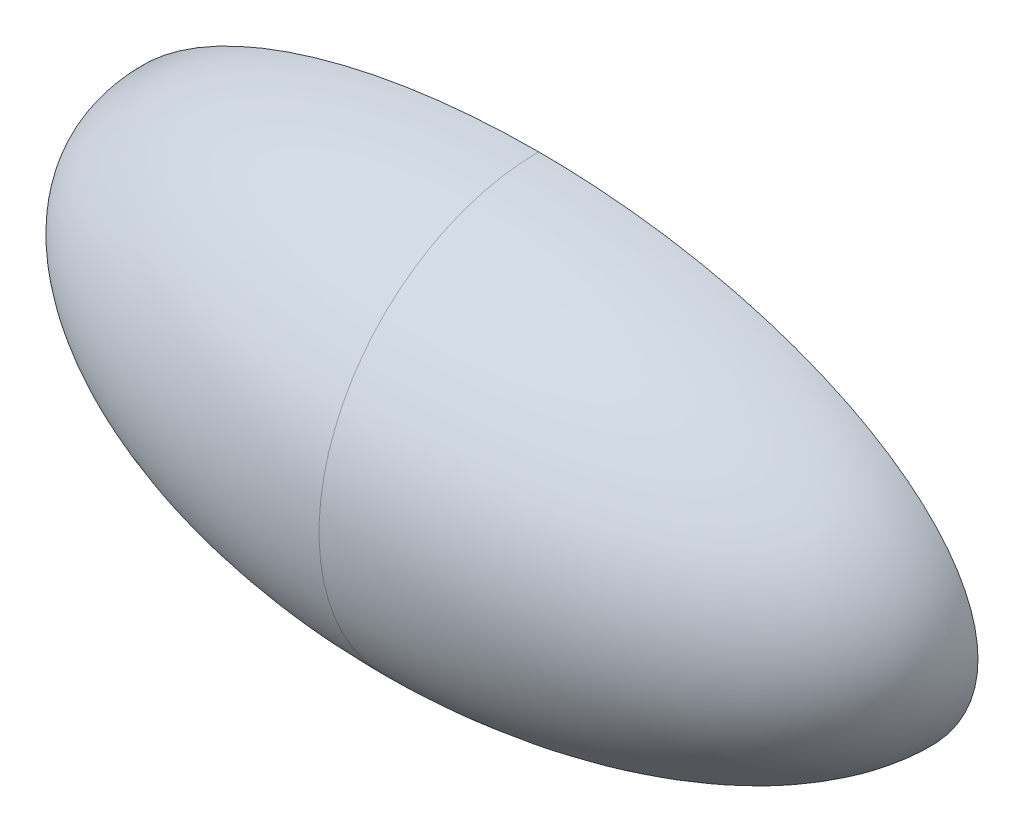
from build123d import *

# Parameters (mm, degrees)
REVOLVE1_ANGLE = 180


with BuildPart() as part:
    # Sketch1 → Revolve1 (revolve)
    with BuildSketch(Plane.XY):
        with BuildLine():
            Line((-12.049635499, 0), (12, 0))
            add(Edge.make_bspline(
                [(12, 0), (12, 6), (0, 6)],
                knots=[0, 0, 0, 1.570796327, 1.570796327, 1.570796327], degree=2, weights=[1, 0.707106781, 1]))
            add(Edge.make_bspline(
                [(0, 6), (-12.049635499, 6), (-12.049635499, 0)],
                knots=[4.71238898, 4.71238898, 4.71238898, 6.283185307, 6.283185307, 6.283185307], degree=2, weights=[1, 0.707106781, 1]))
        make_face()
    revolve(axis=Axis((-12.049635499, 0, 0), (1, 0, 0)), revolution_arc=REVOLVE1_ANGLE)


solid = part.part
